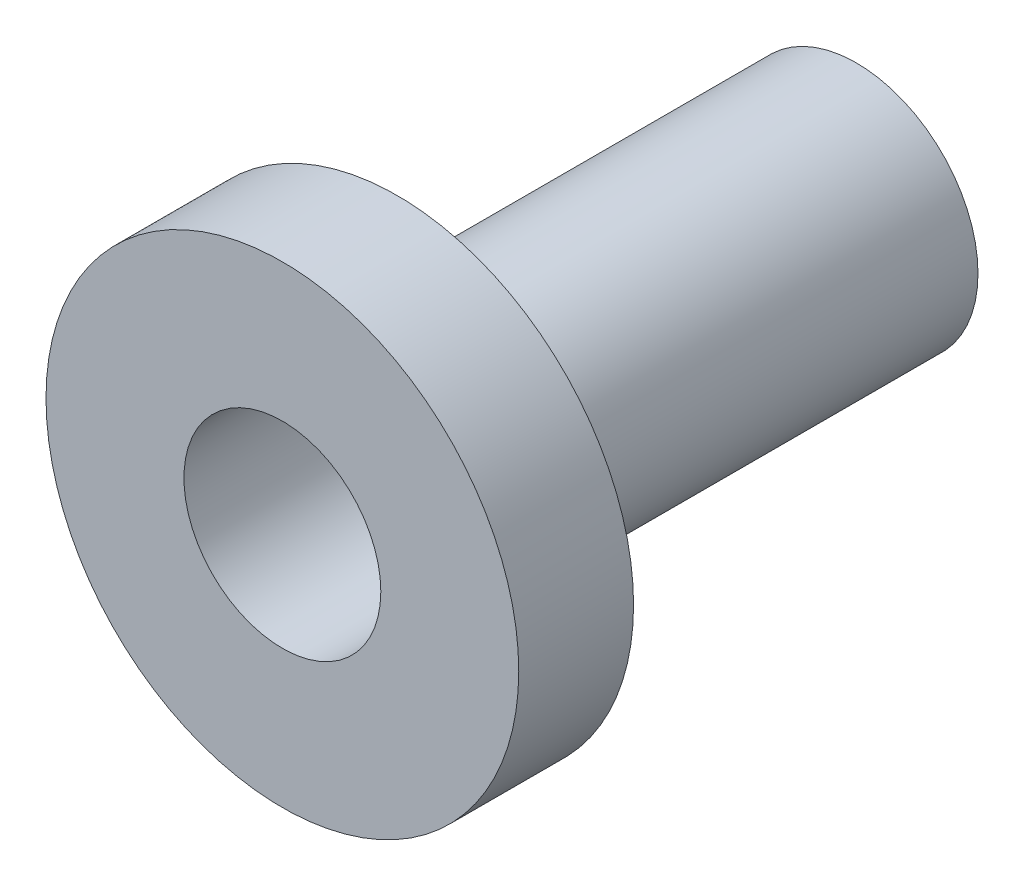
from build123d import *

# Parameters (mm, degrees)
SKETCH1_R           = 18
BOSS_EXTRUDE1_DEPTH = 85
SKETCH2_R           = 14.576002813
CUT_EXTRUDE1_DEPTH  = 60
SKETCH3_R           = 4.364419647
CUT_EXTRUDE2_DEPTH  = 60
SKETCH4_R           = 35
SKETCH4_R_2         = 14.576002813
BOSS_EXTRUDE2_DEPTH = 17
CUT_EXTRUDE3_START  = -13
SKETCH5_R           = 3.181436575
CUT_EXTRUDE3_DEPTH  = 4


with BuildPart() as part:
    # Sketch1 → Boss-Extrude1 (new body)
    with BuildSketch(Plane.XY):
        Circle(SKETCH1_R)
    extrude(amount=BOSS_EXTRUDE1_DEPTH)

    # Sketch2 → Cut-Extrude1 (cut)
    with BuildSketch(Plane.XY.offset(85)):
        Circle(SKETCH2_R)
    extrude(amount=-CUT_EXTRUDE1_DEPTH, mode=Mode.SUBTRACT)

    # Sketch3 → Cut-Extrude2 (cut)
    with BuildSketch(Plane(origin=(0, 0, 0), x_dir=(-1, 0, 0), z_dir=(0, 0, -1))):
        Circle(SKETCH3_R)
    extrude(amount=-CUT_EXTRUDE2_DEPTH, mode=Mode.SUBTRACT)

    # Sketch4 → Boss-Extrude2 (add)
    with BuildSketch(Plane.XY.offset(85)):
        Circle(SKETCH4_R)
        Circle(SKETCH4_R_2, mode=Mode.SUBTRACT)
    extrude(amount=-BOSS_EXTRUDE2_DEPTH)

    # Sketch5 → Cut-Extrude3 (cut)
    with BuildSketch(Plane.XY.offset(85).offset(CUT_EXTRUDE3_START)):
        with Locations((1.618994911, -28.119385301)):
            Circle(SKETCH5_R)
    extrude(amount=-CUT_EXTRUDE3_DEPTH, mode=Mode.SUBTRACT)


solid = part.part
